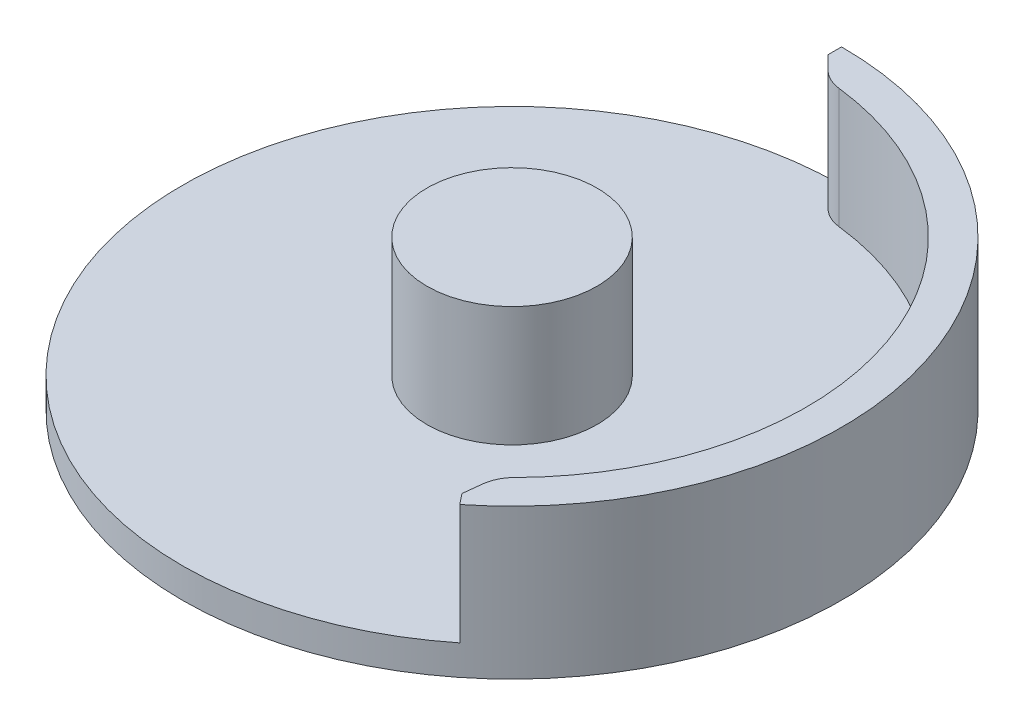
from build123d import *
from build123d.topology import SkipClean

# Parameters (mm, degrees)
SKETCH1_R           = 27.5
BOSS_EXTRUDE1_DEPTH = 2.5
SKETCH2_R           = 7.1
BOSS_EXTRUDE2_DEPTH = 10
BOSS_EXTRUDE3_DEPTH = 10
CHAMFER1_SIZE       = 1.8
FILLET2_R           = 3


with BuildPart() as part:
    # Sketch1 → Boss-Extrude1 (new body)
    with BuildSketch(Plane(origin=(0, 0, 0), x_dir=(1, 0, 0), z_dir=(0, 1, 0))):
        with Locations(Location((0, 0, 0), (0, 0, 270))):
            Circle(SKETCH1_R)
    extrude(amount=BOSS_EXTRUDE1_DEPTH)

    # Sketch2 → Boss-Extrude2 (add)
    with BuildSketch(Plane(origin=(0, 2.5, 0), x_dir=(1, 0, 0), z_dir=(0, 1, 0))):
        with Locations(Location((0, 0, 0), (0, 0, 270))):
            Circle(SKETCH2_R)
    extrude(amount=BOSS_EXTRUDE2_DEPTH)

    # Sketch5 → Boss-Extrude3 (add)
    with SkipClean():  # the faces are left unmerged after this step: merging them gives an invalid solid
        with BuildSketch(Plane(origin=(0, 2.5, 0), x_dir=(1, 0, 0), z_dir=(0, 1, 0))):
            with BuildLine():
                Line((0, 24.57), (0, 27.5))
                ThreePointArc((0, 27.5), (25.957349719, 9.081078988), (17.143326771, -21.502473049))
                Line((17.143326771, -21.502473049), (15.316783228, -19.211482284))
                ThreePointArc((15.316783228, -19.211482284), (23.191712094, 8.113531299), (0, 24.57))
            make_face()
        extrude(amount=BOSS_EXTRUDE3_DEPTH)

    # Chamfer1
    # the kernel refuses this chamfer: 1.8 mm, written as the material it takes off along each edge
    with BuildSketch(Plane(origin=(0, 2.5, -24.57), x_dir=(0, 0, -1), z_dir=(0, 1, 0))) as chamfer1_piece_1:
        with BuildLine():
            Line((CHAMFER1_SIZE, 0), (-0.071369946, -1.871369946))
            ThreePointArc((-0.071369946, -1.871369946), (-0.018871327, -0.96279846), (0, 0))
            Line((0, 0), (CHAMFER1_SIZE, 0))
        make_face()
    extrude(amount=14.815417609, mode=Mode.SUBTRACT)
    with BuildSketch(Plane(origin=(15.316783228, 2.5, 19.211482284), x_dir=(0.7575824934147944, 0, -0.652739431681144), z_dir=(0, 1, 0))) as chamfer1_piece_2:
        with BuildLine():
            Line((1.872730398, 0), (-CHAMFER1_SIZE * 0.0381101017104, -CHAMFER1_SIZE * 0.999273546206))
            Line((-CHAMFER1_SIZE * 0.0381101017104, -CHAMFER1_SIZE * 0.999273546206), (0, 0))
            ThreePointArc((0, 0), (0.962818219, -0.01783473), (1.872730398, 0))
        make_face()
    extrude(amount=14.815417609, mode=Mode.SUBTRACT)

    # Fillet2
    fillet2_edges = [part.edges().sort_by_distance(p)[0] for p in [
        (1.871369946, 7.5, -24.498630054),
        (16.735530992, 7.5, 17.989077308),
    ]]
    fillet(fillet2_edges, radius=FILLET2_R)


solid = part.part
